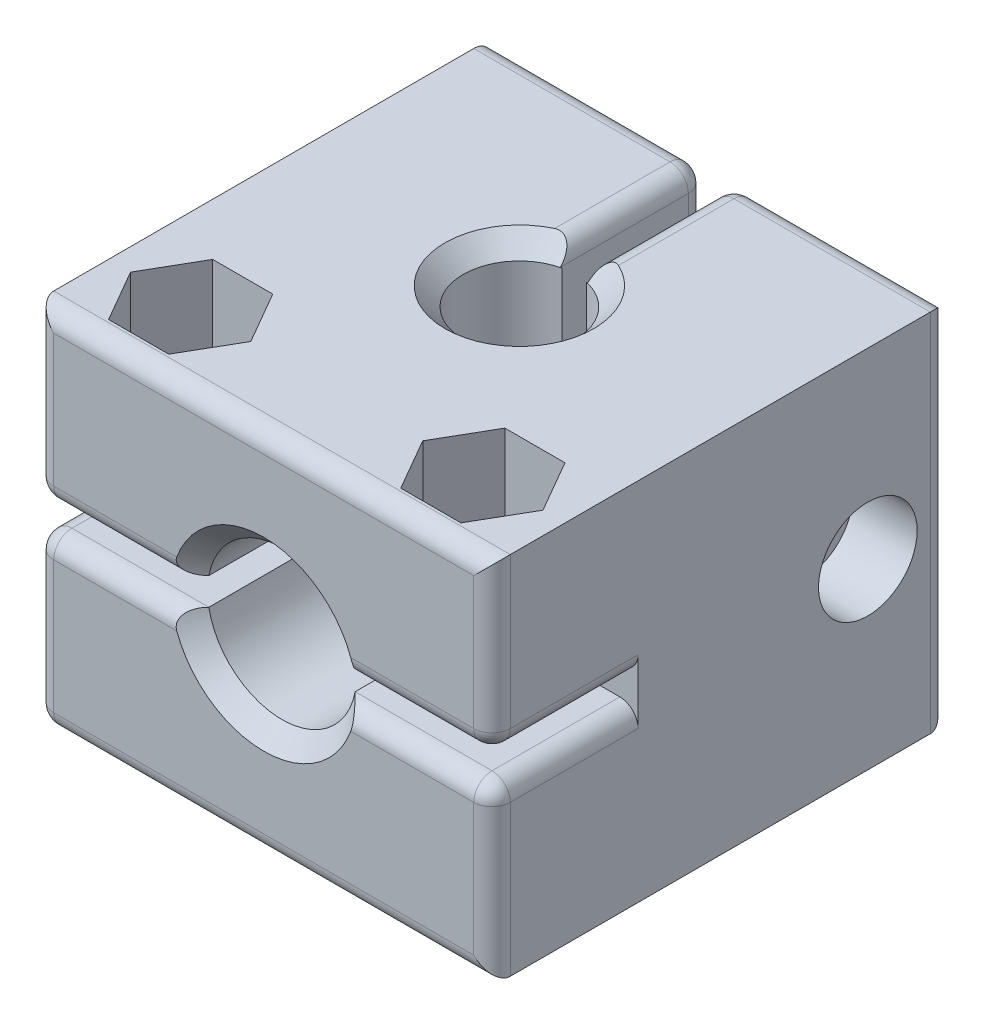
from build123d import *

# Parameters (mm, degrees)
SKIZZE1_W                        = 20
SKIZZE1_H                        = 25
AUFSATZ_LINEAR_AUSTRAGEN1_DEPTH  = 25
SKIZZE2_W                        = 1.5
SKIZZE2_H                        = 8
SCHNITT_PENDEL_DEPTH             = 20
SKIZZE3_R                        = 3.075
LOCH_PENDEL_DEPTH                = 20
SKIZZE6_W                        = 25
SKIZZE6_H                        = 1.5
SCHNITT_WELLE_DEPTH              = 8
SKIZZE7_R                        = 4.075
LOCH_WELLE_DEPTH                 = 8
SKIZZE9_R                        = 1.7
SCHNITT_LINEAR_AUSTRAGEN9_DEPTH  = 25
SKIZZE10_R                       = 2.7
SCHNITT_LINEAR_AUSTRAGEN10_DEPTH = 3.5
SCHNITT_LINEAR_AUSTRAGEN11_DEPTH = 5
SKIZZE13_R                       = 1.7
SCHNITT_LINEAR_AUSTRAGEN12_DEPTH = 25
SKIZZE15_R                       = 2.7
SCHNITT_LINEAR_AUSTRAGEN13_DEPTH = 3.5
SCHNITT_LINEAR_AUSTRAGEN14_DEPTH = 5
FASE1_SIZE                       = 1
VERRUNDUNG5_R                    = 1
VERRUNDUNG6_R                    = 1


with BuildPart() as part:
    # Skizze1 → Aufsatz-Linear austragen1 (new body)
    with BuildSketch(Plane(origin=(0, 0, 0), x_dir=(0, 1, 0), z_dir=(0, 0, 1))):
        Rectangle(SKIZZE1_W, SKIZZE1_H)
    extrude(amount=AUFSATZ_LINEAR_AUSTRAGEN1_DEPTH)

    # Skizze2 → Schnitt Pendel (cut)
    with BuildSketch(Plane.XZ.offset(10)):
        with Locations((0, 4)):
            Rectangle(SKIZZE2_W, SKIZZE2_H)
    extrude(amount=-SCHNITT_PENDEL_DEPTH, mode=Mode.SUBTRACT)

    # Skizze3 → Loch Pendel (cut)
    with BuildSketch(Plane.XZ.offset(10)):
        with Locations((0, 11)):
            Circle(SKIZZE3_R)
    extrude(amount=-LOCH_PENDEL_DEPTH, mode=Mode.SUBTRACT)

    # Skizze6 → Schnitt Welle (cut)
    with BuildSketch(Plane.XY.offset(25)):
        Rectangle(SKIZZE6_W, SKIZZE6_H)
    extrude(amount=-SCHNITT_WELLE_DEPTH, mode=Mode.SUBTRACT)

    # Skizze7 → Loch Welle (cut)
    with BuildSketch(Plane.XY.offset(25)):
        Circle(SKIZZE7_R)
    extrude(amount=-LOCH_WELLE_DEPTH, mode=Mode.SUBTRACT)

    # Skizze9 → Schnitt-Linear austragen9 (cut)
    with BuildSketch(Plane.YZ.offset(12.5)):
        with Locations(Location((0, 4.42, 0), (0, 0, 270))):
            Circle(SKIZZE9_R)
    extrude(amount=-SCHNITT_LINEAR_AUSTRAGEN9_DEPTH, mode=Mode.SUBTRACT)

    # Skizze10 → Schnitt-Linear austragen10 (cut)
    with BuildSketch(Plane.YZ.offset(12.5)):
        with Locations(Location((0, 4.42, 0), (0, 0, 270))):
            Circle(SKIZZE10_R)
    extrude(amount=-SCHNITT_LINEAR_AUSTRAGEN10_DEPTH, mode=Mode.SUBTRACT)

    # Skizze11 → Schnitt-Linear austragen11 (cut)
    with BuildSketch(Plane(origin=(-12.5, 0, 0), x_dir=(0, -1, 0), z_dir=(-1, 0, 0))):
        Polygon((3.290896534, 4.42), (1.645448267, 7.27), (-1.645448267, 7.27), (-3.290896534, 4.42), (-1.645448267, 1.57), (1.645448267, 1.57), align=None)
    extrude(amount=-SCHNITT_LINEAR_AUSTRAGEN11_DEPTH, mode=Mode.SUBTRACT)

    # Skizze13 → Schnitt-Linear austragen12 (cut)
    with BuildSketch(Plane.XZ.offset(10)):
        with Locations(Location((-8, 21, 0), (0, 0, 270))):
            Circle(SKIZZE13_R)
        with Locations(Location((8, 21, 0), (0, 0, 270))):
            Circle(SKIZZE13_R)
    extrude(amount=-SCHNITT_LINEAR_AUSTRAGEN12_DEPTH, mode=Mode.SUBTRACT)

    # Skizze15 → Schnitt-Linear austragen13 (cut)
    with BuildSketch(Plane.XZ.offset(10)):
        with Locations(Location((-8, 21, 0), (0, 0, 270))):
            Circle(SKIZZE15_R)
        with Locations(Location((8, 21, 0), (0, 0, 270))):
            Circle(SKIZZE15_R)
    extrude(amount=-SCHNITT_LINEAR_AUSTRAGEN13_DEPTH, mode=Mode.SUBTRACT)

    # Skizze16 → Schnitt-Linear austragen14 (cut)
    with BuildSketch(Plane(origin=(0, 10, 0), x_dir=(-1, 0, 0), z_dir=(0, 1, 0))):
        Polygon((11.290896534, 21), (9.645448267, 23.85), (6.354551733, 23.85), (4.709103466, 21), (6.354551733, 18.15), (9.645448267, 18.15), align=None)
        Polygon((-4.709103466, 21), (-6.354551733, 23.85), (-9.645448267, 23.85), (-11.290896534, 21), (-9.645448267, 18.15), (-6.354551733, 18.15), align=None)
    extrude(amount=-SCHNITT_LINEAR_AUSTRAGEN14_DEPTH, mode=Mode.SUBTRACT)

    # Fase1
    fase1_edges = [part.edges().sort_by_distance(p)[0] for p in [
        (0, -10, 14.075),
        (0, 4.075, 25),
        (0, -4.075, 25),
        (0, 10, 14.075),
    ]]
    chamfer(fase1_edges, length=FASE1_SIZE)

    # Verrundung5
    # the kernel refuses this fillet: 1 mm, written as the material it takes off along each edge
    with BuildSketch(Plane(origin=(12.5, 0.75, 27.5), x_dir=(0, 1, 0), z_dir=(0, 0, -1)), Plane(origin=(-12.5, -0.75, 27.5), x_dir=(0, -1, 0), z_dir=(0, 0, -1))) as verrundung5_piece_1:
        with BuildLine():
            CenterArc((VERRUNDUNG5_R, -VERRUNDUNG5_R), VERRUNDUNG5_R, 90, 90)
            Line((0, -VERRUNDUNG5_R), (0, 0))
            Line((0, 0), (VERRUNDUNG5_R, 0))
        make_face()
    extrude(amount=10.5, mode=Mode.SUBTRACT)
    with BuildSketch(Plane(origin=(12.5, -0.75, 27.5), x_dir=(0, -1, 0), z_dir=(0, 0, -1)), Plane(origin=(-12.5, 0.75, 27.5), x_dir=(0, 1, 0), z_dir=(0, 0, -1))) as verrundung5_piece_2:
        with BuildLine():
            CenterArc((VERRUNDUNG5_R, VERRUNDUNG5_R), VERRUNDUNG5_R, 180, 90)
            Line((0, VERRUNDUNG5_R), (0, 0))
            Line((0, 0), (VERRUNDUNG5_R, 0))
        make_face()
    extrude(amount=10.5, mode=Mode.SUBTRACT)
    with BuildSketch(Plane(origin=(-0.75, 10, 9.494613002), x_dir=(0, -1, 0), z_dir=(0, 0, -1))) as verrundung5_piece_3_section:
        with BuildLine():
            CenterArc((VERRUNDUNG5_R, VERRUNDUNG5_R), VERRUNDUNG5_R, 180, 90)
            Line((0, VERRUNDUNG5_R), (0, 0))
            Line((0, 0), (VERRUNDUNG5_R, 0))
        make_face()
    verrundung5_piece_3 = extrude(amount=11.994613002, mode=Mode.PRIVATE)
    verrundung5_piece_3 = split(verrundung5_piece_3, bisect_by=Plane(origin=(-0.971795619, 9.77244026, 8), z_dir=(0, 0, -1)), keep=Keep.TOP, mode=Mode.PRIVATE)
    add(verrundung5_piece_3, mode=Mode.SUBTRACT)
    with BuildSketch(Plane(origin=(0.75, 10, -2.5), x_dir=(0, -1, 0), z_dir=(0, 0, 1))) as verrundung5_piece_4_section:
        with BuildLine():
            CenterArc((VERRUNDUNG5_R, VERRUNDUNG5_R), VERRUNDUNG5_R, 180, 90)
            Line((0, VERRUNDUNG5_R), (0, 0))
            Line((0, 0), (VERRUNDUNG5_R, 0))
        make_face()
    verrundung5_piece_4 = extrude(amount=11.994613002, mode=Mode.PRIVATE)
    verrundung5_piece_4 = split(verrundung5_piece_4, bisect_by=Plane(origin=(0.971795687, 9.772440059, 8), z_dir=(0, 0, -1)), keep=Keep.TOP, mode=Mode.PRIVATE)
    add(verrundung5_piece_4, mode=Mode.SUBTRACT)
    with BuildSketch(Plane(origin=(-0.75, -10, 9.494613002), x_dir=(-1, 0, 0), z_dir=(0, 0, -1))) as verrundung5_piece_5_section:
        with BuildLine():
            CenterArc((VERRUNDUNG5_R, VERRUNDUNG5_R), VERRUNDUNG5_R, 180, 90)
            Line((0, VERRUNDUNG5_R), (0, 0))
            Line((0, 0), (VERRUNDUNG5_R, 0))
        make_face()
    verrundung5_piece_5 = extrude(amount=11.994613002, mode=Mode.PRIVATE)
    verrundung5_piece_5 = split(verrundung5_piece_5, bisect_by=Plane(origin=(-0.971795692, -9.772440079, 8), z_dir=(0, 0, -1)), keep=Keep.TOP, mode=Mode.PRIVATE)
    add(verrundung5_piece_5, mode=Mode.SUBTRACT)
    with BuildSketch(Plane(origin=(0.75, -10, -2.5), x_dir=(1, 0, 0), z_dir=(0, 0, 1))) as verrundung5_piece_6_section:
        with BuildLine():
            CenterArc((VERRUNDUNG5_R, VERRUNDUNG5_R), VERRUNDUNG5_R, 180, 90)
            Line((0, VERRUNDUNG5_R), (0, 0))
            Line((0, 0), (VERRUNDUNG5_R, 0))
        make_face()
    verrundung5_piece_6 = extrude(amount=11.994613002, mode=Mode.PRIVATE)
    verrundung5_piece_6 = split(verrundung5_piece_6, bisect_by=Plane(origin=(0.971795678, -9.772440107, 8), z_dir=(0, 0, -1)), keep=Keep.TOP, mode=Mode.PRIVATE)
    add(verrundung5_piece_6, mode=Mode.SUBTRACT)
    with BuildSketch(Plane(origin=(-0.75, -12.5, 0), x_dir=(0, 0, 1), z_dir=(0, 1, 0))) as verrundung5_piece_7:
        with BuildLine():
            CenterArc((VERRUNDUNG5_R, -VERRUNDUNG5_R), VERRUNDUNG5_R, 90, 90)
            Line((0, -VERRUNDUNG5_R), (0, 0))
            Line((0, 0), (VERRUNDUNG5_R, 0))
        make_face()
    extrude(amount=25, mode=Mode.SUBTRACT)
    with BuildSketch(Plane(origin=(0.75, -12.5, 0), x_dir=(0, 0, 1), z_dir=(0, 1, 0))) as verrundung5_piece_8:
        with BuildLine():
            CenterArc((VERRUNDUNG5_R, VERRUNDUNG5_R), VERRUNDUNG5_R, 180, 90)
            Line((0, VERRUNDUNG5_R), (0, 0))
            Line((0, 0), (VERRUNDUNG5_R, 0))
        make_face()
    extrude(amount=25, mode=Mode.SUBTRACT)
    with BuildSketch(Plane(origin=(-2.519275346, 0.75, 25), x_dir=(0, 1, 0), z_dir=(-1, 0, 0)), Plane(origin=(-15, -0.75, 25), x_dir=(0, -1, 0), z_dir=(1, 0, 0)), Plane(origin=(15, 0.75, 25), x_dir=(0, 1, 0), z_dir=(-1, 0, 0)), Plane(origin=(2.519275346, -0.75, 25), x_dir=(0, -1, 0), z_dir=(1, 0, 0))) as verrundung5_piece_9:
        with BuildLine():
            CenterArc((VERRUNDUNG5_R, VERRUNDUNG5_R), VERRUNDUNG5_R, 180, 90)
            Line((0, VERRUNDUNG5_R), (0, 0))
            Line((0, 0), (VERRUNDUNG5_R, 0))
        make_face()
    extrude(amount=12.480724654, mode=Mode.SUBTRACT)

    # Verrundung6
    # the kernel refuses this fillet: 1 mm, written as the material it takes off along each edge
    with BuildSketch(Plane(origin=(11.5, 1.75, 24), x_dir=(0, 0, 1), z_dir=(1, 0, 0))) as verrundung6_piece_1_section:
        Polygon((0, 0), (VERRUNDUNG6_R, 0), (VERRUNDUNG6_R, VERRUNDUNG6_R), (0, VERRUNDUNG6_R), align=None)
    verrundung6_piece_1 = extrude(amount=VERRUNDUNG6_R, mode=Mode.PRIVATE)
    verrundung6_piece_1 = verrundung6_piece_1 - Plane(origin=(11.5, 1.75, 24), x_dir=(0, 0.7071067811865475, -0.7071067811865475), z_dir=(1, 0, 0)) * Sphere(VERRUNDUNG6_R, mode=Mode.PRIVATE)
    add(verrundung6_piece_1, mode=Mode.SUBTRACT)
    with BuildSketch(Plane(origin=(11.5, -1.75, 24), x_dir=(0, 0, 1), z_dir=(1, 0, 0))) as verrundung6_piece_2_section:
        Polygon((0, 0), (VERRUNDUNG6_R, 0), (VERRUNDUNG6_R, -VERRUNDUNG6_R), (0, -VERRUNDUNG6_R), align=None)
    verrundung6_piece_2 = extrude(amount=VERRUNDUNG6_R, mode=Mode.PRIVATE)
    verrundung6_piece_2 = verrundung6_piece_2 - Plane(origin=(11.5, -1.75, 24), x_dir=(0, -0.7071067811865475, -0.7071067811865475), z_dir=(1, 0, 0)) * Sphere(VERRUNDUNG6_R, mode=Mode.PRIVATE)
    add(verrundung6_piece_2, mode=Mode.SUBTRACT)
    with BuildSketch(Plane(origin=(-11.5, 1.75, 24), x_dir=(0, 0, 1), z_dir=(-1, 0, 0))) as verrundung6_piece_3_section:
        Polygon((0, 0), (VERRUNDUNG6_R, 0), (VERRUNDUNG6_R, -VERRUNDUNG6_R), (0, -VERRUNDUNG6_R), align=None)
    verrundung6_piece_3 = extrude(amount=VERRUNDUNG6_R, mode=Mode.PRIVATE)
    verrundung6_piece_3 = verrundung6_piece_3 - Plane(origin=(-11.5, 1.75, 24), x_dir=(0, 0.7071067811865475, -0.7071067811865475), z_dir=(-1, 0, 0)) * Sphere(VERRUNDUNG6_R, mode=Mode.PRIVATE)
    add(verrundung6_piece_3, mode=Mode.SUBTRACT)
    with BuildSketch(Plane(origin=(-11.5, -1.75, 24), x_dir=(-1, 0, 0), z_dir=(0, 0, 1))) as verrundung6_piece_4_section:
        Polygon((0, 0), (VERRUNDUNG6_R, 0), (VERRUNDUNG6_R, -VERRUNDUNG6_R), (0, -VERRUNDUNG6_R), align=None)
    verrundung6_piece_4 = extrude(amount=VERRUNDUNG6_R, mode=Mode.PRIVATE)
    verrundung6_piece_4 = verrundung6_piece_4 - Plane(origin=(-11.5, -1.75, 24), x_dir=(0.7071067811865475, -0.7071067811865475, 0), z_dir=(0, 0, 1)) * Sphere(VERRUNDUNG6_R, mode=Mode.PRIVATE)
    add(verrundung6_piece_4, mode=Mode.SUBTRACT)
    with BuildSketch(Plane(origin=(-1.75, -9, 1), x_dir=(0, 0, -1), z_dir=(0, -1, 0))) as verrundung6_piece_5_section:
        Polygon((0, 0), (VERRUNDUNG6_R, 0), (VERRUNDUNG6_R, VERRUNDUNG6_R), (0, VERRUNDUNG6_R), align=None)
    verrundung6_piece_5 = extrude(amount=VERRUNDUNG6_R, mode=Mode.PRIVATE)
    verrundung6_piece_5 = verrundung6_piece_5 - Plane(origin=(-1.75, -9, 1), x_dir=(-0.7071067811865475, 0, 0.7071067811865475), z_dir=(0, -1, 0)) * Sphere(VERRUNDUNG6_R, mode=Mode.PRIVATE)
    add(verrundung6_piece_5, mode=Mode.SUBTRACT)
    with BuildSketch(Plane(origin=(-1.75, 9, 1), x_dir=(0, 1, 0), z_dir=(0, 0, -1))) as verrundung6_piece_6_section:
        Polygon((0, 0), (VERRUNDUNG6_R, 0), (VERRUNDUNG6_R, VERRUNDUNG6_R), (0, VERRUNDUNG6_R), align=None)
    verrundung6_piece_6 = extrude(amount=VERRUNDUNG6_R, mode=Mode.PRIVATE)
    verrundung6_piece_6 = verrundung6_piece_6 - Plane(origin=(-1.75, 9, 1), x_dir=(-0.7071067811865475, -0.7071067811865475, 0), z_dir=(0, 0, -1)) * Sphere(VERRUNDUNG6_R, mode=Mode.PRIVATE)
    add(verrundung6_piece_6, mode=Mode.SUBTRACT)
    with BuildSketch(Plane(origin=(1.75, -9, 1), x_dir=(0, 0, -1), z_dir=(0, -1, 0))) as verrundung6_piece_7_section:
        Polygon((0, 0), (VERRUNDUNG6_R, 0), (VERRUNDUNG6_R, -VERRUNDUNG6_R), (0, -VERRUNDUNG6_R), align=None)
    verrundung6_piece_7 = extrude(amount=VERRUNDUNG6_R, mode=Mode.PRIVATE)
    verrundung6_piece_7 = verrundung6_piece_7 - Plane(origin=(1.75, -9, 1), x_dir=(0.7071067811865475, 0, 0.7071067811865475), z_dir=(0, -1, 0)) * Sphere(VERRUNDUNG6_R, mode=Mode.PRIVATE)
    add(verrundung6_piece_7, mode=Mode.SUBTRACT)
    with BuildSketch(Plane(origin=(1.75, 9, 1), x_dir=(0, 1, 0), z_dir=(0, 0, -1))) as verrundung6_piece_8_section:
        Polygon((0, 0), (VERRUNDUNG6_R, 0), (VERRUNDUNG6_R, -VERRUNDUNG6_R), (0, -VERRUNDUNG6_R), align=None)
    verrundung6_piece_8 = extrude(amount=VERRUNDUNG6_R, mode=Mode.PRIVATE)
    verrundung6_piece_8 = verrundung6_piece_8 - Plane(origin=(1.75, 9, 1), x_dir=(0.7071067811865475, -0.7071067811865475, 0), z_dir=(0, 0, -1)) * Sphere(VERRUNDUNG6_R, mode=Mode.PRIVATE)
    add(verrundung6_piece_8, mode=Mode.SUBTRACT)
    with BuildSketch(Plane(origin=(-11.5, -9, 24), x_dir=(0, 0, 1), z_dir=(0, -1, 0))) as verrundung6_piece_9_section:
        Polygon((0, 0), (VERRUNDUNG6_R, 0), (VERRUNDUNG6_R, VERRUNDUNG6_R), (0, VERRUNDUNG6_R), align=None)
    verrundung6_piece_9 = extrude(amount=VERRUNDUNG6_R, mode=Mode.PRIVATE)
    verrundung6_piece_9 = verrundung6_piece_9 - Plane(origin=(-11.5, -9, 24), x_dir=(0.7071067811865475, 0, -0.7071067811865475), z_dir=(0, -1, 0)) * Sphere(VERRUNDUNG6_R, mode=Mode.PRIVATE)
    add(verrundung6_piece_9, mode=Mode.SUBTRACT)
    with BuildSketch(Plane(origin=(-11.5, -10, 25), x_dir=(0, 0, -1), z_dir=(1, 0, 0)), Plane(origin=(-12.5, -10, -2.5), x_dir=(1, 0, 0), z_dir=(0, 0, 1))) as verrundung6_piece_10:
        with BuildLine():
            CenterArc((VERRUNDUNG6_R, VERRUNDUNG6_R), VERRUNDUNG6_R, 180, 90)
            Line((0, VERRUNDUNG6_R), (0, 0))
            Line((0, 0), (VERRUNDUNG6_R, 0))
        make_face()
    extrude(amount=26.5, mode=Mode.SUBTRACT)
    with BuildSketch(Plane(origin=(12.5, -12.5, 25), x_dir=(0, 0, -1), z_dir=(0, 1, 0)), Plane(origin=(12.5, 1.75, 25), x_dir=(0, 0, -1), z_dir=(0, 1, 0)), Plane(origin=(-12.5, 12.5, 25), x_dir=(0, 0, -1), z_dir=(0, -1, 0))) as verrundung6_piece_11:
        with BuildLine():
            CenterArc((VERRUNDUNG6_R, VERRUNDUNG6_R), VERRUNDUNG6_R, 180, 90)
            Line((0, VERRUNDUNG6_R), (0, 0))
            Line((0, 0), (VERRUNDUNG6_R, 0))
        make_face()
    extrude(amount=10.75, mode=Mode.SUBTRACT)
    with BuildSketch(Plane(origin=(-12.5, -1.75, 25), x_dir=(1, 0, 0), z_dir=(0, -1, 0))) as verrundung6_piece_12:
        with BuildLine():
            CenterArc((VERRUNDUNG6_R, -VERRUNDUNG6_R), VERRUNDUNG6_R, 90, 90)
            Line((0, -VERRUNDUNG6_R), (0, 0))
            Line((0, 0), (VERRUNDUNG6_R, 0))
        make_face()
    extrude(amount=7.25, mode=Mode.SUBTRACT)
    with BuildSketch(Plane(origin=(-1.75, 10, 0), x_dir=(0, -1, 0), z_dir=(-1, 0, 0)), Plane(origin=(15, 10, 0), x_dir=(0, -1, 0), z_dir=(-1, 0, 0))) as verrundung6_piece_13:
        with BuildLine():
            CenterArc((VERRUNDUNG6_R, VERRUNDUNG6_R), VERRUNDUNG6_R, 180, 90)
            Line((0, VERRUNDUNG6_R), (0, 0))
            Line((0, 0), (VERRUNDUNG6_R, 0))
        make_face()
    extrude(amount=13.25, mode=Mode.SUBTRACT)
    with BuildSketch(Plane(origin=(1.75, -10, 0), x_dir=(0, 0, 1), z_dir=(1, 0, 0)), Plane(origin=(-15, -10, 0), x_dir=(0, 0, 1), z_dir=(1, 0, 0))) as verrundung6_piece_14:
        with BuildLine():
            CenterArc((VERRUNDUNG6_R, -VERRUNDUNG6_R), VERRUNDUNG6_R, 90, 90)
            Line((0, -VERRUNDUNG6_R), (0, 0))
            Line((0, 0), (VERRUNDUNG6_R, 0))
        make_face()
    extrude(amount=13.25, mode=Mode.SUBTRACT)
    with BuildSketch(Plane(origin=(15, 10, 25), x_dir=(0, 0, -1), z_dir=(-1, 0, 0))) as verrundung6_piece_15:
        with BuildLine():
            CenterArc((VERRUNDUNG6_R, VERRUNDUNG6_R), VERRUNDUNG6_R, 180, 90)
            Line((0, VERRUNDUNG6_R), (0, 0))
            Line((0, 0), (VERRUNDUNG6_R, 0))
        make_face()
    extrude(amount=30, mode=Mode.SUBTRACT)
    with BuildSketch(Plane(origin=(12.5, -12.5, 0), x_dir=(-1, 0, 0), z_dir=(0, 1, 0))) as verrundung6_piece_16:
        with BuildLine():
            CenterArc((VERRUNDUNG6_R, VERRUNDUNG6_R), VERRUNDUNG6_R, 180, 90)
            Line((0, VERRUNDUNG6_R), (0, 0))
            Line((0, 0), (VERRUNDUNG6_R, 0))
        make_face()
    extrude(amount=25, mode=Mode.SUBTRACT)


solid = part.part
